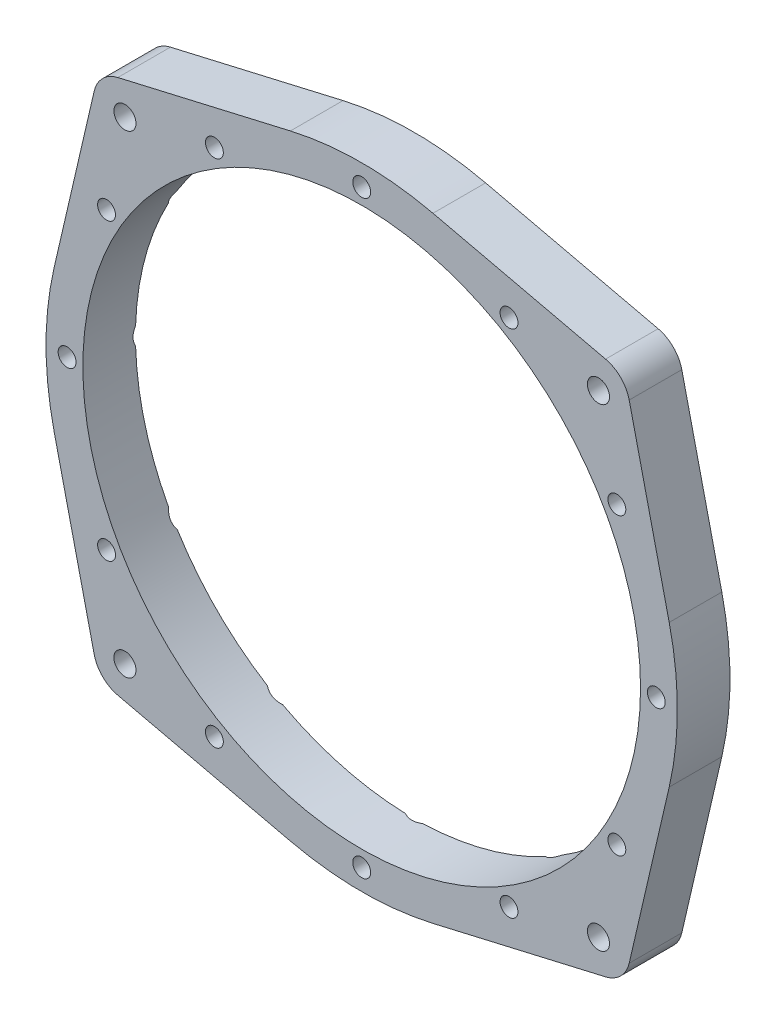
from build123d import *

# Parameters (mm, degrees)
SKETCH_1_R                     = 2.1
SKETCH_1_R_2                   = 1.6
SKETCH_1_R_3                   = 53
EXTRUDE_1_DEPTH                = 10
HOLE_WIZARD_M3_2_D             = 3.4
HOLE_WIZARD_M3_2_CSINK_D       = 6.94
HOLE_WIZARD_M3_2_CSINK_ANGLE   = 90
PATTERN_CIRCULAR_1_OUTLINE_R   = 1.7
PATTERN_CIRCULAR_1_OUTLINE_R_2 = 1.6
PATTERN_CIRCULAR_1_DEPTH       = 11


with BuildPart() as part:
    # 草图1 → 凸台-拉伸1 (new body)
    with BuildSketch(Plane.XY):
        with BuildLine():
            Line((-50.844994432, 46.355005568), (-58.449944321, 13.550055679))
            ThreePointArc((-58.449944321, 13.550055679), (-60, 0), (-58.449944321, -13.550055679))
            Line((-58.449944321, -13.550055679), (-50.844994432, -46.355005568))
            ThreePointArc((-50.844994432, -46.355005568), (-49.242640687, -49.242640687), (-46.355005568, -50.844994432))
            Line((-46.355005568, -50.844994432), (-13.550055679, -58.449944321))
            ThreePointArc((-13.550055679, -58.449944321), (0, -60), (13.550055679, -58.449944321))
            Line((13.550055679, -58.449944321), (46.355005568, -50.844994432))
            ThreePointArc((46.355005568, -50.844994432), (49.242640687, -49.242640687), (50.844994432, -46.355005568))
            Line((50.844994432, -46.355005568), (58.449944321, -13.550055679))
            ThreePointArc((58.449944321, -13.550055679), (60, 0), (58.449944321, 13.550055679))
            Line((58.449944321, 13.550055679), (50.844994432, 46.355005568))
            ThreePointArc((50.844994432, 46.355005568), (49.242640687, 49.242640687), (46.355005568, 50.844994432))
            Line((46.355005568, 50.844994432), (13.550055679, 58.449944321))
            ThreePointArc((13.550055679, 58.449944321), (0, 60), (-13.550055679, 58.449944321))
            Line((-13.550055679, 58.449944321), (-46.355005568, 50.844994432))
            ThreePointArc((-46.355005568, 50.844994432), (-49.242640687, 49.242640687), (-50.844994432, 46.355005568))
        make_face()
        with Locations((45, 45)):
            Circle(SKETCH_1_R, mode=Mode.SUBTRACT)
        with Locations((-45, 45)):
            Circle(SKETCH_1_R, mode=Mode.SUBTRACT)
        with Locations((-45, -45)):
            Circle(SKETCH_1_R, mode=Mode.SUBTRACT)
        with Locations((45, -45)):
            Circle(SKETCH_1_R, mode=Mode.SUBTRACT)
        with Locations((0, 56)):
            Circle(SKETCH_1_R_2, mode=Mode.SUBTRACT)
        with Locations((28, 48.497422612)):
            Circle(SKETCH_1_R_2, mode=Mode.SUBTRACT)
        with Locations((48.497422612, 28)):
            Circle(SKETCH_1_R_2, mode=Mode.SUBTRACT)
        with Locations((56, 0)):
            Circle(SKETCH_1_R_2, mode=Mode.SUBTRACT)
        with Locations((48.497422612, -28)):
            Circle(SKETCH_1_R_2, mode=Mode.SUBTRACT)
        with Locations((28, -48.497422612)):
            Circle(SKETCH_1_R_2, mode=Mode.SUBTRACT)
        with Locations((0, -56)):
            Circle(SKETCH_1_R_2, mode=Mode.SUBTRACT)
        with Locations((-28, -48.497422612)):
            Circle(SKETCH_1_R_2, mode=Mode.SUBTRACT)
        with Locations((-48.497422612, -28)):
            Circle(SKETCH_1_R_2, mode=Mode.SUBTRACT)
        with Locations((-56, 0)):
            Circle(SKETCH_1_R_2, mode=Mode.SUBTRACT)
        with Locations((-48.497422612, 28)):
            Circle(SKETCH_1_R_2, mode=Mode.SUBTRACT)
        with Locations((-28, 48.497422612)):
            Circle(SKETCH_1_R_2, mode=Mode.SUBTRACT)
        Circle(SKETCH_1_R_3, mode=Mode.SUBTRACT)
    extrude(amount=EXTRUDE_1_DEPTH)

    # M3 六角凹锥坑头螺钉的锥形沉头孔2 (through all)
    with Locations(Plane(origin=(0, 0, 0), x_dir=(-1, 0, 0), z_dir=(0, 0, -1))):
        with Locations((0, 56)):
            CounterSinkHole(HOLE_WIZARD_M3_2_D / 2, HOLE_WIZARD_M3_2_CSINK_D / 2, counter_sink_angle=HOLE_WIZARD_M3_2_CSINK_ANGLE)

    # 阵列(圆周)1: read off the stored shape, not the designer's step
    # 阵列(圆周)1 outline → 阵列(圆周)1 (cut)
    # profile 1 of 11: a face of its own
    with BuildSketch(Plane.XY):
        with Locations((28, 48.497422612)):
            Circle(PATTERN_CIRCULAR_1_OUTLINE_R)
        with Locations((28, 48.497422612)):
            Circle(PATTERN_CIRCULAR_1_OUTLINE_R_2, mode=Mode.SUBTRACT)
    # profile 2 of 11: a face of its own
    with BuildSketch(Plane.XY):
        with Locations((48.497422612, 28)):
            Circle(PATTERN_CIRCULAR_1_OUTLINE_R)
        with Locations((48.497422612, 28)):
            Circle(PATTERN_CIRCULAR_1_OUTLINE_R_2, mode=Mode.SUBTRACT)
    # profile 3 of 11: a face of its own
    with BuildSketch(Plane.XY):
        with Locations((56, 0)):
            Circle(PATTERN_CIRCULAR_1_OUTLINE_R)
        with Locations((56, 0)):
            Circle(PATTERN_CIRCULAR_1_OUTLINE_R_2, mode=Mode.SUBTRACT)
    # profile 4 of 11: a face of its own
    with BuildSketch(Plane.XY):
        with Locations((48.497422612, -28)):
            Circle(PATTERN_CIRCULAR_1_OUTLINE_R)
        with Locations((48.497422612, -28)):
            Circle(PATTERN_CIRCULAR_1_OUTLINE_R_2, mode=Mode.SUBTRACT)
    # profile 5 of 11: a face of its own
    with BuildSketch(Plane.XY):
        with Locations((28, -48.497422612)):
            Circle(PATTERN_CIRCULAR_1_OUTLINE_R)
        with Locations((28, -48.497422612)):
            Circle(PATTERN_CIRCULAR_1_OUTLINE_R_2, mode=Mode.SUBTRACT)
    # profile 6 of 11: a face of its own
    with BuildSketch(Plane.XY):
        with Locations((0, -56)):
            Circle(PATTERN_CIRCULAR_1_OUTLINE_R)
        with Locations((0, -56)):
            Circle(PATTERN_CIRCULAR_1_OUTLINE_R_2, mode=Mode.SUBTRACT)
    # profile 7 of 11: a face of its own
    with BuildSketch(Plane.XY):
        with Locations((-28, -48.497422612)):
            Circle(PATTERN_CIRCULAR_1_OUTLINE_R)
        with Locations((-28, -48.497422612)):
            Circle(PATTERN_CIRCULAR_1_OUTLINE_R_2, mode=Mode.SUBTRACT)
    # profile 8 of 11: a face of its own
    with BuildSketch(Plane.XY):
        with Locations((-48.497422612, -28)):
            Circle(PATTERN_CIRCULAR_1_OUTLINE_R)
        with Locations((-48.497422612, -28)):
            Circle(PATTERN_CIRCULAR_1_OUTLINE_R_2, mode=Mode.SUBTRACT)
    # profile 9 of 11: a face of its own
    with BuildSketch(Plane.XY):
        with Locations((-56, 0)):
            Circle(PATTERN_CIRCULAR_1_OUTLINE_R)
        with Locations((-56, 0)):
            Circle(PATTERN_CIRCULAR_1_OUTLINE_R_2, mode=Mode.SUBTRACT)
    # profile 10 of 11: a face of its own
    with BuildSketch(Plane.XY):
        with Locations((-48.497422612, 28)):
            Circle(PATTERN_CIRCULAR_1_OUTLINE_R)
        with Locations((-48.497422612, 28)):
            Circle(PATTERN_CIRCULAR_1_OUTLINE_R_2, mode=Mode.SUBTRACT)
    # profile 11 of 11: a face of its own
    with BuildSketch(Plane.XY):
        with Locations((-28, 48.497422612)):
            Circle(PATTERN_CIRCULAR_1_OUTLINE_R)
        with Locations((-28, 48.497422612)):
            Circle(PATTERN_CIRCULAR_1_OUTLINE_R_2, mode=Mode.SUBTRACT)
    extrude(amount=PATTERN_CIRCULAR_1_DEPTH, mode=Mode.SUBTRACT)

    # Pattern Circular 1 2: loft between two sections, ruled curve by curve
    pattern_circular_1_2_from = [
        Edge.make_three_point_arc((26.3, 48.497422612, 1.77), (28, 50.197422612, 1.77), (29.7, 48.497422612, 1.77)),
        Edge.make_three_point_arc((29.7, 48.497422612, 1.77), (28, 46.797422612, 1.77), (26.3, 48.497422612, 1.77)),
    ]
    pattern_circular_1_2_to = [
        Edge.make_three_point_arc((24.529999939, 48.497422612, -6.1e-08), (28, 51.967422673, -6.1e-08), (31.470000061, 48.497422612, -6.1e-08)),
        Edge.make_three_point_arc((31.470000061, 48.497422612, -6.1e-08), (28, 45.027422551, -6.1e-08), (24.529999939, 48.497422612, -6.1e-08)),
    ]
    pattern_circular_1_2 = Solid(Shell([*[Face.make_surface_from_curves(pattern_circular_1_2_from[k], pattern_circular_1_2_to[k]) for k in range(2)], Face(Wire(pattern_circular_1_2_from)), Face(Wire(pattern_circular_1_2_to))]))
    add(pattern_circular_1_2, mode=Mode.SUBTRACT)

    # Pattern Circular 1 3: loft between two sections, ruled curve by curve
    pattern_circular_1_3_from = [
        Edge.make_three_point_arc((46.797422612, 28, 1.77), (48.497422612, 29.7, 1.77), (50.197422612, 28, 1.77)),
        Edge.make_three_point_arc((50.197422612, 28, 1.77), (48.497422612, 26.3, 1.77), (46.797422612, 28, 1.77)),
    ]
    pattern_circular_1_3_to = [
        Edge.make_three_point_arc((45.027422551, 28, -6.1e-08), (48.497422612, 31.470000061, -6.1e-08), (51.967422673, 28, -6.1e-08)),
        Edge.make_three_point_arc((51.967422673, 28, -6.1e-08), (48.497422612, 24.529999939, -6.1e-08), (45.027422551, 28, -6.1e-08)),
    ]
    pattern_circular_1_3 = Solid(Shell([*[Face.make_surface_from_curves(pattern_circular_1_3_from[k], pattern_circular_1_3_to[k]) for k in range(2)], Face(Wire(pattern_circular_1_3_from)), Face(Wire(pattern_circular_1_3_to))]))
    add(pattern_circular_1_3, mode=Mode.SUBTRACT)

    # Pattern Circular 1 4: loft between two sections, ruled curve by curve
    pattern_circular_1_4_from = [
        Edge.make_three_point_arc((54.3, 0, 1.77), (56, 1.7, 1.77), (57.7, 0, 1.77)),
        Edge.make_three_point_arc((57.7, 0, 1.77), (56, -1.7, 1.77), (54.3, 0, 1.77)),
    ]
    pattern_circular_1_4_to = [
        Edge.make_three_point_arc((52.529999939, 0, -6.1e-08), (56, 3.470000061, -6.1e-08), (59.470000061, 0, -6.1e-08)),
        Edge.make_three_point_arc((59.470000061, 0, -6.1e-08), (56, -3.470000061, -6.1e-08), (52.529999939, 0, -6.1e-08)),
    ]
    pattern_circular_1_4 = Solid(Shell([*[Face.make_surface_from_curves(pattern_circular_1_4_from[k], pattern_circular_1_4_to[k]) for k in range(2)], Face(Wire(pattern_circular_1_4_from)), Face(Wire(pattern_circular_1_4_to))]))
    add(pattern_circular_1_4, mode=Mode.SUBTRACT)

    # Pattern Circular 1 5: loft between two sections, ruled curve by curve
    pattern_circular_1_5_from = [
        Edge.make_three_point_arc((46.797422612, -28, 1.77), (48.497422612, -26.3, 1.77), (50.197422612, -28, 1.77)),
        Edge.make_three_point_arc((50.197422612, -28, 1.77), (48.497422612, -29.7, 1.77), (46.797422612, -28, 1.77)),
    ]
    pattern_circular_1_5_to = [
        Edge.make_three_point_arc((45.027422551, -28, -6.1e-08), (48.497422612, -24.529999939, -6.1e-08), (51.967422673, -28, -6.1e-08)),
        Edge.make_three_point_arc((51.967422673, -28, -6.1e-08), (48.497422612, -31.470000061, -6.1e-08), (45.027422551, -28, -6.1e-08)),
    ]
    pattern_circular_1_5 = Solid(Shell([*[Face.make_surface_from_curves(pattern_circular_1_5_from[k], pattern_circular_1_5_to[k]) for k in range(2)], Face(Wire(pattern_circular_1_5_from)), Face(Wire(pattern_circular_1_5_to))]))
    add(pattern_circular_1_5, mode=Mode.SUBTRACT)

    # Pattern Circular 1 6: loft between two sections, ruled curve by curve
    pattern_circular_1_6_from = [
        Edge.make_three_point_arc((26.3, -48.497422612, 1.77), (28, -46.797422612, 1.77), (29.7, -48.497422612, 1.77)),
        Edge.make_three_point_arc((29.7, -48.497422612, 1.77), (28, -50.197422612, 1.77), (26.3, -48.497422612, 1.77)),
    ]
    pattern_circular_1_6_to = [
        Edge.make_three_point_arc((24.529999939, -48.497422612, -6.1e-08), (28, -45.027422551, -6.1e-08), (31.470000061, -48.497422612, -6.1e-08)),
        Edge.make_three_point_arc((31.470000061, -48.497422612, -6.1e-08), (28, -51.967422673, -6.1e-08), (24.529999939, -48.497422612, -6.1e-08)),
    ]
    pattern_circular_1_6 = Solid(Shell([*[Face.make_surface_from_curves(pattern_circular_1_6_from[k], pattern_circular_1_6_to[k]) for k in range(2)], Face(Wire(pattern_circular_1_6_from)), Face(Wire(pattern_circular_1_6_to))]))
    add(pattern_circular_1_6, mode=Mode.SUBTRACT)

    # Pattern Circular 1 7: loft between two sections, ruled curve by curve
    pattern_circular_1_7_from = [
        Edge.make_three_point_arc((-1.7, -56, 1.77), (0, -54.3, 1.77), (1.7, -56, 1.77)),
        Edge.make_three_point_arc((1.7, -56, 1.77), (0, -57.7, 1.77), (-1.7, -56, 1.77)),
    ]
    pattern_circular_1_7_to = [
        Edge.make_three_point_arc((-3.470000061, -56, -6.1e-08), (0, -52.529999939, -6.1e-08), (3.470000061, -56, -6.1e-08)),
        Edge.make_three_point_arc((3.470000061, -56, -6.1e-08), (0, -59.470000061, -6.1e-08), (-3.470000061, -56, -6.1e-08)),
    ]
    pattern_circular_1_7 = Solid(Shell([*[Face.make_surface_from_curves(pattern_circular_1_7_from[k], pattern_circular_1_7_to[k]) for k in range(2)], Face(Wire(pattern_circular_1_7_from)), Face(Wire(pattern_circular_1_7_to))]))
    add(pattern_circular_1_7, mode=Mode.SUBTRACT)

    # Pattern Circular 1 8: loft between two sections, ruled curve by curve
    pattern_circular_1_8_from = [
        Edge.make_three_point_arc((-29.7, -48.497422612, 1.77), (-28, -46.797422612, 1.77), (-26.3, -48.497422612, 1.77)),
        Edge.make_three_point_arc((-26.3, -48.497422612, 1.77), (-28, -50.197422612, 1.77), (-29.7, -48.497422612, 1.77)),
    ]
    pattern_circular_1_8_to = [
        Edge.make_three_point_arc((-31.470000061, -48.497422612, -6.1e-08), (-28, -45.027422551, -6.1e-08), (-24.529999939, -48.497422612, -6.1e-08)),
        Edge.make_three_point_arc((-24.529999939, -48.497422612, -6.1e-08), (-28, -51.967422673, -6.1e-08), (-31.470000061, -48.497422612, -6.1e-08)),
    ]
    pattern_circular_1_8 = Solid(Shell([*[Face.make_surface_from_curves(pattern_circular_1_8_from[k], pattern_circular_1_8_to[k]) for k in range(2)], Face(Wire(pattern_circular_1_8_from)), Face(Wire(pattern_circular_1_8_to))]))
    add(pattern_circular_1_8, mode=Mode.SUBTRACT)

    # Pattern Circular 1 9: loft between two sections, ruled curve by curve
    pattern_circular_1_9_from = [
        Edge.make_three_point_arc((-50.197422612, -28, 1.77), (-48.497422612, -26.3, 1.77), (-46.797422612, -28, 1.77)),
        Edge.make_three_point_arc((-46.797422612, -28, 1.77), (-48.497422612, -29.7, 1.77), (-50.197422612, -28, 1.77)),
    ]
    pattern_circular_1_9_to = [
        Edge.make_three_point_arc((-51.967422673, -28, -6.1e-08), (-48.497422612, -24.529999939, -6.1e-08), (-45.027422551, -28, -6.1e-08)),
        Edge.make_three_point_arc((-45.027422551, -28, -6.1e-08), (-48.497422612, -31.470000061, -6.1e-08), (-51.967422673, -28, -6.1e-08)),
    ]
    pattern_circular_1_9 = Solid(Shell([*[Face.make_surface_from_curves(pattern_circular_1_9_from[k], pattern_circular_1_9_to[k]) for k in range(2)], Face(Wire(pattern_circular_1_9_from)), Face(Wire(pattern_circular_1_9_to))]))
    add(pattern_circular_1_9, mode=Mode.SUBTRACT)

    # Pattern Circular 1 10: loft between two sections, ruled curve by curve
    pattern_circular_1_10_from = [
        Edge.make_three_point_arc((-57.7, 0, 1.77), (-56, 1.7, 1.77), (-54.3, 0, 1.77)),
        Edge.make_three_point_arc((-54.3, 0, 1.77), (-56, -1.7, 1.77), (-57.7, 0, 1.77)),
    ]
    pattern_circular_1_10_to = [
        Edge.make_three_point_arc((-59.470000061, 0, -6.1e-08), (-56, 3.470000061, -6.1e-08), (-52.529999939, 0, -6.1e-08)),
        Edge.make_three_point_arc((-52.529999939, 0, -6.1e-08), (-56, -3.470000061, -6.1e-08), (-59.470000061, 0, -6.1e-08)),
    ]
    pattern_circular_1_10 = Solid(Shell([*[Face.make_surface_from_curves(pattern_circular_1_10_from[k], pattern_circular_1_10_to[k]) for k in range(2)], Face(Wire(pattern_circular_1_10_from)), Face(Wire(pattern_circular_1_10_to))]))
    add(pattern_circular_1_10, mode=Mode.SUBTRACT)

    # Pattern Circular 1 11: loft between two sections, ruled curve by curve
    pattern_circular_1_11_from = [
        Edge.make_three_point_arc((-50.197422612, 28, 1.77), (-48.497422612, 29.7, 1.77), (-46.797422612, 28, 1.77)),
        Edge.make_three_point_arc((-46.797422612, 28, 1.77), (-48.497422612, 26.3, 1.77), (-50.197422612, 28, 1.77)),
    ]
    pattern_circular_1_11_to = [
        Edge.make_three_point_arc((-51.967422673, 28, -6.1e-08), (-48.497422612, 31.470000061, -6.1e-08), (-45.027422551, 28, -6.1e-08)),
        Edge.make_three_point_arc((-45.027422551, 28, -6.1e-08), (-48.497422612, 24.529999939, -6.1e-08), (-51.967422673, 28, -6.1e-08)),
    ]
    pattern_circular_1_11 = Solid(Shell([*[Face.make_surface_from_curves(pattern_circular_1_11_from[k], pattern_circular_1_11_to[k]) for k in range(2)], Face(Wire(pattern_circular_1_11_from)), Face(Wire(pattern_circular_1_11_to))]))
    add(pattern_circular_1_11, mode=Mode.SUBTRACT)

    # Pattern Circular 1 12: loft between two sections, ruled curve by curve
    pattern_circular_1_12_from = [
        Edge.make_three_point_arc((-29.7, 48.497422612, 1.77), (-28, 50.197422612, 1.77), (-26.3, 48.497422612, 1.77)),
        Edge.make_three_point_arc((-26.3, 48.497422612, 1.77), (-28, 46.797422612, 1.77), (-29.7, 48.497422612, 1.77)),
    ]
    pattern_circular_1_12_to = [
        Edge.make_three_point_arc((-31.470000061, 48.497422612, -6.1e-08), (-28, 51.967422673, -6.1e-08), (-24.529999939, 48.497422612, -6.1e-08)),
        Edge.make_three_point_arc((-24.529999939, 48.497422612, -6.1e-08), (-28, 45.027422551, -6.1e-08), (-31.470000061, 48.497422612, -6.1e-08)),
    ]
    pattern_circular_1_12 = Solid(Shell([*[Face.make_surface_from_curves(pattern_circular_1_12_from[k], pattern_circular_1_12_to[k]) for k in range(2)], Face(Wire(pattern_circular_1_12_from)), Face(Wire(pattern_circular_1_12_to))]))
    add(pattern_circular_1_12, mode=Mode.SUBTRACT)


solid = part.part
